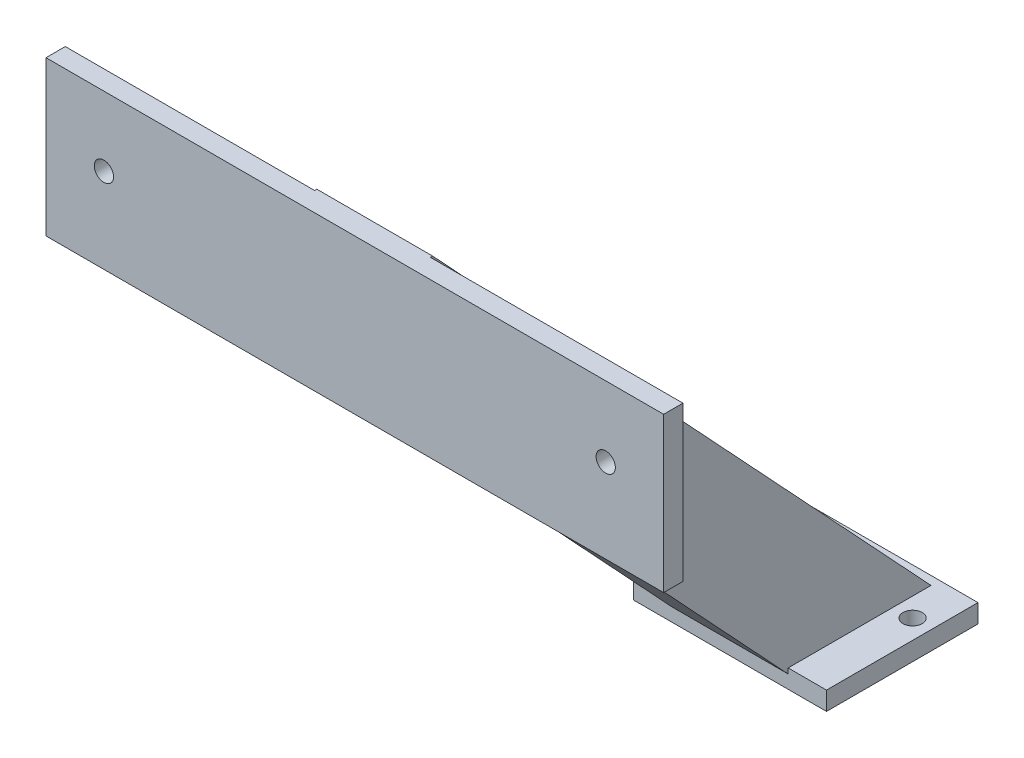
from build123d import *

# Parameters (mm, degrees)
SKETCH1_W               = 160
SKETCH1_H               = 40
BOSS_EXTRUDE1_DEPTH     = 5
SKETCH10_W              = 198.079975954
SKETCH10_H              = 30
BOSS_EXTRUDE3_DEPTH     = 14
CUT_EXTRUDE1_DEPTH      = 30
CUT_EXTRUDE4_DEPTH      = 211.957211927
SKETCH18_R              = 2.5
CUT_EXTRUDE5_DEPTH      = 205.997748991
CUT_EXTRUDE6_DEPTH      = 211.957211927
SKETCH20_W              = 50
SKETCH20_H              = 39.252056472
BOSS_EXTRUDE4_DEPTH     = 2.4
SKETCH21_R              = 2.5
CUT_EXTRUDE7_DEPTH      = 210.905831678
CUT_EXTRUDE9_DEPTH      = 1
CUT_EXTRUDE9_DEPTH_BACK = 1
SKETCH22_W              = 31.718044436
SKETCH22_H              = 7.429479552
CUT_EXTRUDE10_DEPTH     = 1


with BuildPart() as part:
    # Sketch1 → Boss-Extrude1 (new body)
    with BuildSketch(Plane.XY):
        with Locations((0.417519507, 5.949920674)):
            Rectangle(SKETCH1_W, SKETCH1_H)
    extrude(amount=BOSS_EXTRUDE1_DEPTH)

    # Sketch10 → Boss-Extrude3 (add, symmetric)
    with BuildSketch(Plane(origin=(0, 2.811339594, -3.014792614), x_dir=(0, -0.7313537016191695, -0.6819983600624997), z_dir=(0, 0.6819983600624997, -0.7313537016191695))):
        with Locations((75.491069918, 0)):
            Rectangle(SKETCH10_W, SKETCH10_H)
    extrude(amount=BOSS_EXTRUDE3_DEPTH, both=True)

    # Sketch12 → Cut-Extrude1 (cut)
    with BuildSketch(Plane.ZY.offset(15)):
        Polygon((5, -9.121756188), (20.705445577, 7.720272225), (2.806579061, 29.581905027), (-0.580301141, 25.949920674), (5, 25.949920674), align=None)
    extrude(amount=-CUT_EXTRUDE1_DEPTH, mode=Mode.SUBTRACT)


with BuildPart() as cut_extrude1_piece_1:
    # of the separate pieces the step leaves, piece 1, a body of its own (cut_extrude1_pieces)
    add(part.part.solids().sort_by_distance((-79.582480493, 25.949920674, 0))[0])

    # Sketch18 → Cut-Extrude5 (cut, through all)
    with BuildSketch(Plane(origin=(0, 0, 0), x_dir=(-1, 0, 0), z_dir=(0, 0, -1))):
        with Locations((-65.417519507, 7.738264691)):
            Circle(SKETCH18_R)
        with Locations((64.582480493, 7.969479132)):
            Circle(SKETCH18_R)
    extrude(amount=-CUT_EXTRUDE5_DEPTH, mode=Mode.SUBTRACT)

    # Sketch19 → Cut-Extrude6 (cut, through all)
    with BuildSketch(Plane(origin=(15, 0, 0), x_dir=(0, 0, -1), z_dir=(1, 0, 0))):
        Polygon((132.630964828, -114.903797371), (93.643349246, -114.903797371), (93.643349246, -140.259811882), (133.206173391, -140.259811882), (133.206173391, -115.172797329), align=None)
    extrude(amount=-CUT_EXTRUDE6_DEPTH, mode=Mode.SUBTRACT)

    # Sketch20 → Boss-Extrude4 (add, symmetric)
    with BuildSketch(Plane.XZ.offset(114.903797371)):
        with Locations((-0.068347329, -112.301206211)):
            Rectangle(SKETCH20_W, SKETCH20_H)
    extrude(amount=BOSS_EXTRUDE4_DEPTH, both=True)

    # Sketch21 → Cut-Extrude7 (cut, through all)
    with BuildSketch(Plane(origin=(0, -112.503797371, 0), x_dir=(1, 0, 0), z_dir=(0, 1, 0))):
        with Locations((19.931652671, 119.978116152)):
            Circle(SKETCH21_R)
        with Locations((-20.068347329, 119.90732933)):
            Circle(SKETCH21_R)
    extrude(amount=-CUT_EXTRUDE7_DEPTH, mode=Mode.SUBTRACT)


with BuildPart() as cut_extrude1_piece_2:
    # of the separate pieces the step leaves, piece 2, a body of its own (cut_extrude1_pieces)
    add(part.part.solids().sort_by_distance((-15, 10.485950945, 23.284482706))[0])

    # Sketch17 → Cut-Extrude4 (cut, through all)
    with BuildSketch(Plane(origin=(15, 0, 0), x_dir=(0, 0, -1), z_dir=(1, 0, 0))):
        Polygon((-24.207278746, 10.985937934), (-20.561478453, 7.300935487), (-0.936880315, 30.864566028), align=None)
    extrude(amount=-CUT_EXTRUDE4_DEPTH, mode=Mode.SUBTRACT)

    # Sketch22 → Cut-Extrude9 (cut, two sides: drawn at the far end of the back side and taken through both)
    with BuildSketch(Plane(origin=(0, 17.222588392, 16.060323498), x_dir=(1, 0, 0), z_dir=(0, 0.7313537016191695, 0.6819983600624997)).offset(-CUT_EXTRUDE9_DEPTH_BACK)):
        with Locations((0.866687929, 15.637692298)):
            Rectangle(SKETCH22_W, SKETCH22_H)
    extrude(amount=CUT_EXTRUDE9_DEPTH + CUT_EXTRUDE9_DEPTH_BACK, mode=Mode.SUBTRACT)

    # Sketch23 → Cut-Extrude10 (cut)
    with BuildSketch(Plane.ZY.offset(15)):
        Polygon((2.081574676, 29.407475495), (7.191162477, 25.340141922), (3.657666435, 30.373467218), align=None)
    extrude(amount=-CUT_EXTRUDE10_DEPTH, mode=Mode.SUBTRACT)


solid = cut_extrude1_piece_1.part
